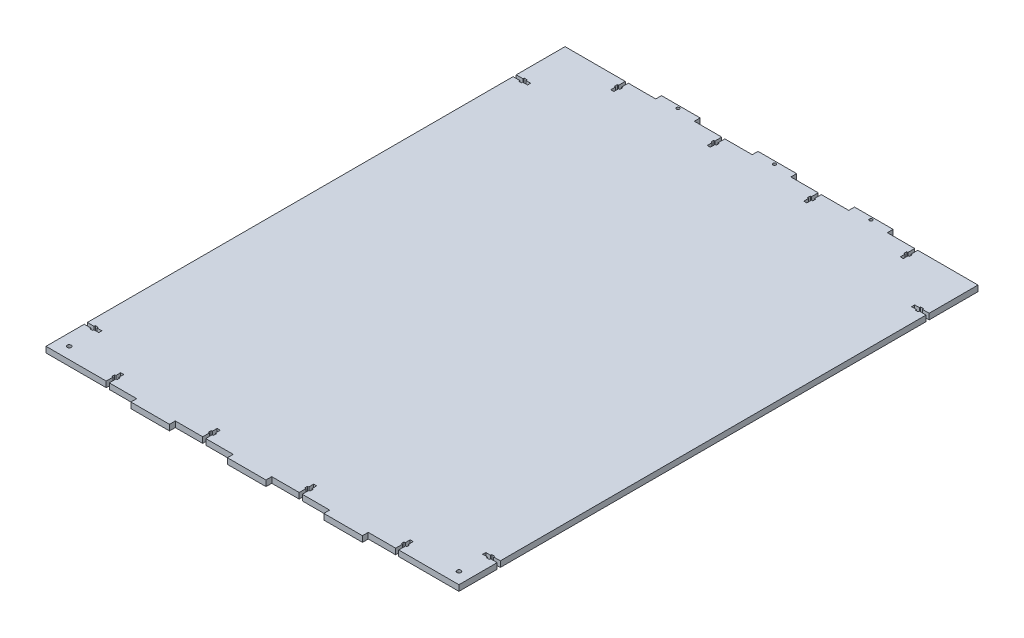
from build123d import *

# Parameters (mm, degrees)
SKETCH1_W           = 428
SKETCH1_H           = 538
BOSS_EXTRUDE1_DEPTH = 6
SKETCH2_W           = 40
SKETCH2_H           = 6
BOSS_EXTRUDE2_DEPTH = 6
SKETCH3_R           = 1.6
SKETCH3_R_2         = 2.1
CUT_EXTRUDE1_DEPTH  = 349.506814854


with BuildPart() as part:
    # Sketch1 → Boss-Extrude1 (new body)
    with BuildSketch(Plane(origin=(0, 0, 0), x_dir=(1, 0, 0), z_dir=(0, 1, 0))):
        Rectangle(SKETCH1_W, SKETCH1_H)
    extrude(amount=BOSS_EXTRUDE1_DEPTH)

    # Sketch2 → Boss-Extrude2 (add)
    with BuildSketch(Plane.XZ):
        with Locations((-100, 272)):
            Rectangle(SKETCH2_W, SKETCH2_H)
        with Locations((0, 272)):
            Rectangle(SKETCH2_W, SKETCH2_H)
        with Locations((100, 272)):
            Rectangle(SKETCH2_W, SKETCH2_H)
        with Locations((100, -272)):
            Rectangle(SKETCH2_W, SKETCH2_H)
        with Locations((0, -272)):
            Rectangle(SKETCH2_W, SKETCH2_H)
        with Locations((-100, -272)):
            Rectangle(SKETCH2_W, SKETCH2_H)
    extrude(amount=-BOSS_EXTRUDE2_DEPTH)

    # Sketch3 → Cut-Extrude1 (cut, through all)
    with BuildSketch(Plane.XZ):
        Polygon((204, -219.55), (207, -219.55), (207, -218.35), (214, -218.35), (214, -215.15), (207, -215.15), (207, -213.95), (204, -213.95), (204, -215.15), (199, -215.15), (199, -218.35), (204, -218.35), align=None)
        Polygon((151.6, 262), (151.6, 269), (148.4, 269), (148.4, 262), (147.2, 262), (147.2, 259), (148.4, 259), (148.4, 254), (151.6, 254), (151.6, 259), (152.8, 259), (152.8, 262), align=None)
        Polygon((207, 226.15), (214, 226.15), (214, 229.35), (207, 229.35), (207, 230.55), (204, 230.55), (204, 229.35), (199, 229.35), (199, 226.15), (204, 226.15), (204, 224.95), (207, 224.95), align=None)
        Polygon((148.4, -269), (151.6, -269), (151.6, -262), (152.8, -262), (152.8, -259), (151.6, -259), (151.6, -254), (148.4, -254), (148.4, -259), (147.2, -259), (147.2, -262), (148.4, -262), align=None)
        Polygon((-214, 229.35), (-214, 226.15), (-207, 226.15), (-207, 224.95), (-204, 224.95), (-204, 226.15), (-199, 226.15), (-199, 229.35), (-204, 229.35), (-204, 230.55), (-207, 230.55), (-207, 229.35), align=None)
        Polygon((-148.4, 269), (-151.6, 269), (-151.6, 262), (-152.8, 262), (-152.8, 259), (-151.6, 259), (-151.6, 254), (-148.4, 254), (-148.4, 259), (-147.2, 259), (-147.2, 262), (-148.4, 262), align=None)
        Polygon((-151.6, -262), (-151.6, -269), (-148.4, -269), (-148.4, -262), (-147.2, -262), (-147.2, -259), (-148.4, -259), (-148.4, -254), (-151.6, -254), (-151.6, -259), (-152.8, -259), (-152.8, -262), align=None)
        Polygon((-207, -215.15), (-214, -215.15), (-214, -218.35), (-207, -218.35), (-207, -219.55), (-204, -219.55), (-204, -218.35), (-199, -218.35), (-199, -215.15), (-204, -215.15), (-204, -213.95), (-207, -213.95), align=None)
        Polygon((51.6, 254), (51.6, 259), (52.8, 259), (52.8, 262), (51.6, 262), (51.6, 269), (48.4, 269), (48.4, 262), (47.2, 262), (47.2, 259), (48.4, 259), (48.4, 254), align=None)
        Polygon((-48.4, 254), (-48.4, 259), (-47.2, 259), (-47.2, 262), (-48.4, 262), (-48.4, 269), (-51.6, 269), (-51.6, 262), (-52.8, 262), (-52.8, 259), (-51.6, 259), (-51.6, 254), align=None)
        Polygon((-48.4, -254), (-51.6, -254), (-51.6, -259), (-52.8, -259), (-52.8, -262), (-51.6, -262), (-51.6, -269), (-48.4, -269), (-48.4, -262), (-47.2, -262), (-47.2, -259), (-48.4, -259), align=None)
        Polygon((51.6, -254), (48.4, -254), (48.4, -259), (47.2, -259), (47.2, -262), (48.4, -262), (48.4, -269), (51.6, -269), (51.6, -262), (52.8, -262), (52.8, -259), (51.6, -259), align=None)
        with Locations((-100, -272)):
            Circle(SKETCH3_R)
        with Locations((0, -272)):
            Circle(SKETCH3_R)
        with Locations((100, -272)):
            Circle(SKETCH3_R)
        with Locations((202, 257)):
            Circle(SKETCH3_R_2)
        with Locations((-202, 257)):
            Circle(SKETCH3_R_2)
    extrude(amount=-CUT_EXTRUDE1_DEPTH, mode=Mode.SUBTRACT)


solid = part.part
